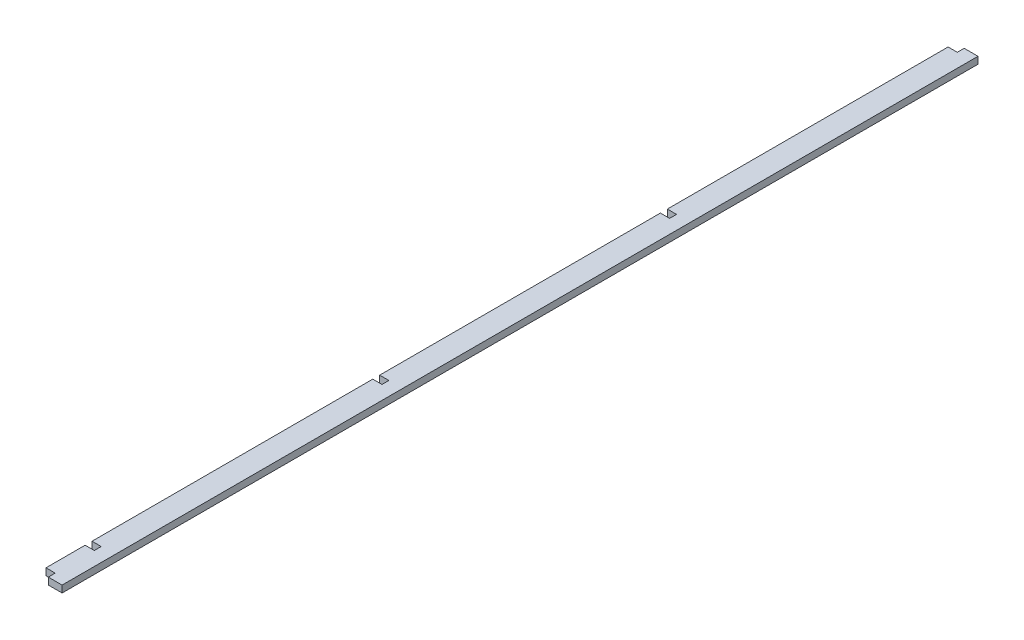
from build123d import *

# Parameters (mm, degrees)
SKETCH_1_W          = 10
SKETCH_1_H          = 3
EXTRUDE_1_DEPTH     = 400
SKETCH_2_W          = 4
SKETCH_2_H          = 3
CUT_EXTRUDE_1_DEPTH = 1168.363523234
SKETCH_3_W          = 10
SKETCH_3_H          = 2
CUT_EXTRUDE_2_DEPTH = 1168.363523234


with BuildPart() as part:
    # 草图1 → 凸台-拉伸1 (new body)
    with BuildSketch(Plane.XY.offset(1160.01)):
        with Locations((125.787596038, -4.889694097)):
            Rectangle(SKETCH_1_W, SKETCH_1_H)
    extrude(amount=-EXTRUDE_1_DEPTH)

    # 草图2 → 切除-拉伸1 (cut, through all)
    with BuildSketch(Plane(origin=(0, -3.389694097, 0), x_dir=(1, 0, 0), z_dir=(0, 1, 0))):
        with Locations((122.787596038, -763.51)):
            Rectangle(SKETCH_2_W, SKETCH_2_H)
        with Locations((122.787596038, -888.51)):
            Rectangle(SKETCH_2_W, SKETCH_2_H)
        with Locations((122.787596038, -1158.51)):
            Rectangle(SKETCH_2_W, SKETCH_2_H)
        with Locations((122.787596038, -1013.51)):
            Rectangle(SKETCH_2_W, SKETCH_2_H)
        with Locations((122.787596038, -1138.51)):
            Rectangle(SKETCH_2_W, SKETCH_2_H)
    extrude(amount=-CUT_EXTRUDE_1_DEPTH, mode=Mode.SUBTRACT)

    # 草图3 → 切除-拉伸2 (cut, through all)
    with BuildSketch(Plane(origin=(0, -3.389694097, 0), x_dir=(1, 0, 0), z_dir=(0, 1, 0))):
        with Locations((125.787596038, -761.01)):
            Rectangle(SKETCH_3_W, SKETCH_3_H)
    extrude(amount=-CUT_EXTRUDE_2_DEPTH, mode=Mode.SUBTRACT)


solid = part.part
